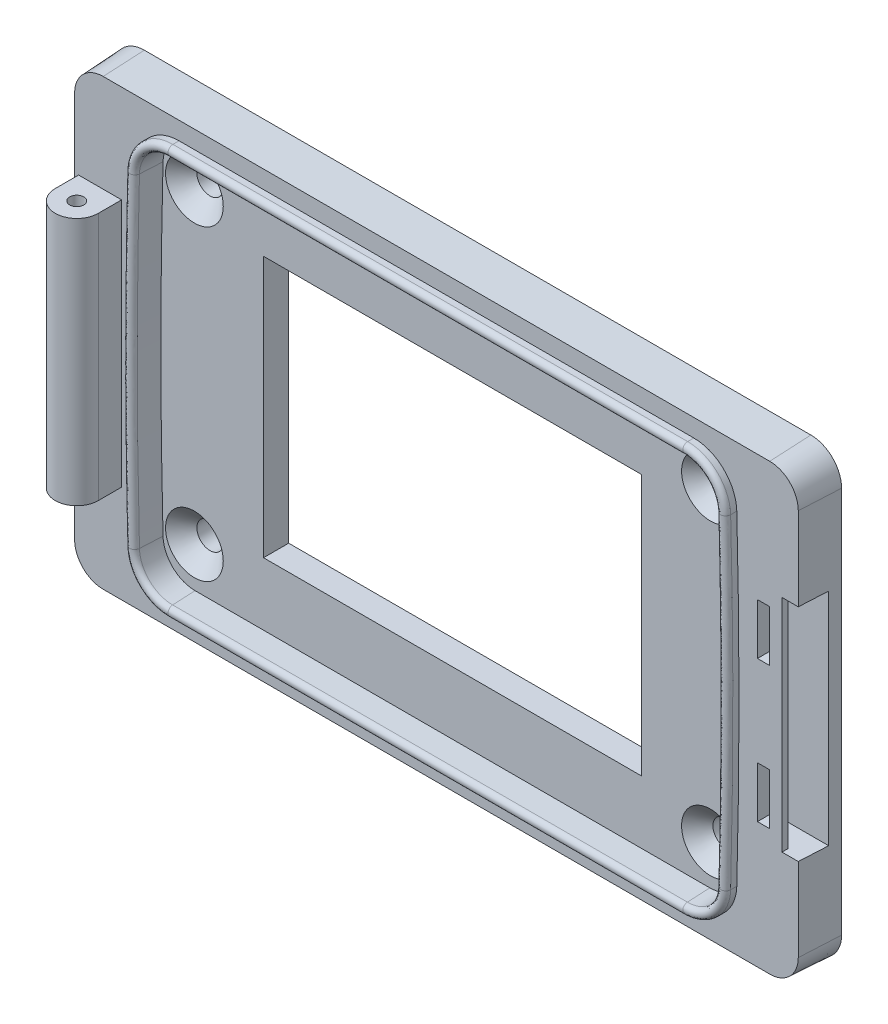
from build123d import *

# Parameters (mm, degrees)
EXTRUDE_1_DEPTH              = 8.5
EXTRUDE_1_DRAFT              = 3
CUT_EXTRUDE_START            = 6.7
CUT_EXTRUDE_1_DEPTH          = 64.407506731
SKETCH_2_R                   = 1.15
EXTRUDE_2_DEPTH              = 20.25
CUT_EXTRUDE_2_DEPTH          = 17.95
CUT_EXTRUDE_START_2          = 2
SKETCH_1_5_W                 = 2
SKETCH_1_5_H                 = 8.3
CUT_EXTRUDE_3_DEPTH          = 69.984593399
SKETCH_1_6_W                 = 61.5
SKETCH_1_6_H                 = 42.5
EXTRUDE_3_DEPTH              = 4.1
SKETCH_1_7_R                 = 3.75
EXTRUDE_4_DEPTH              = 5
HOLE_WIZARD_M4_1_D           = 4.3
HOLE_WIZARD_M4_1_CSINK_D     = 9.4
HOLE_WIZARD_M4_1_CSINK_ANGLE = 90
FILLET_1_R                   = 0.79762


with BuildPart() as part:
    # ｽｹｯﾁ1 → ﾎﾞｽ - 押し出し1 (with draft: the straight prism first)
    with BuildSketch(Plane.XY):
        with BuildLine():
            ThreePointArc((-59.25, -31.5), (-57.785533906, -35.035533906), (-54.25, -36.5))
            Line((-54.25, -36.5), (54.25, -36.5))
            ThreePointArc((54.25, -36.5), (57.785533906, -35.035533906), (59.25, -31.5))
            Line((59.25, -31.5), (59.25, 31.5))
            ThreePointArc((59.25, 31.5), (57.785533906, 35.035533906), (54.25, 36.5))
            Line((54.25, 36.5), (-54.25, 36.5))
            ThreePointArc((-54.25, 36.5), (-57.785533906, 35.035533906), (-59.25, 31.5))
            Line((-59.25, 31.5), (-59.25, -31.5))
        make_face()
        with BuildLine():
            Line((-41.895410903, 31.25), (41.895410903, 31.25))
            ThreePointArc((41.895410903, 31.25), (45.382868101, 29.832965572), (46.893586533, 26.385056917))
            ThreePointArc((46.893586533, 26.385056917), (47.25, 0), (46.893586533, -26.385056917))
            ThreePointArc((46.893586533, -26.385056917), (45.382868101, -29.832965572), (41.895410903, -31.25))
            Line((41.895410903, -31.25), (-41.895410903, -31.25))
            ThreePointArc((-41.895410903, -31.25), (-45.382868101, -29.832965572), (-46.893586533, -26.385056917))
            ThreePointArc((-46.893586533, -26.385056917), (-47.25, 0), (-46.893586533, 26.385056917))
            ThreePointArc((-46.893586533, 26.385056917), (-45.382868101, 29.832965572), (-41.895410903, 31.25))
        make_face(mode=Mode.SUBTRACT)
    extrude(amount=EXTRUDE_1_DEPTH)
    # ﾎﾞｽ - 押し出し1: the draft: its side faces are tilted about the plane it starts from
    extrude_1_sides = [part.faces().sort_by_distance(p)[0] for p in [
        (-57.785533906, -35.035533906, 4.25),
        (0, -36.5, 4.25),
        (57.785533906, -35.035533906, 4.25),
        (59.25, 0, 4.25),
        (57.785533906, 35.035533906, 4.25),
        (0, 36.5, 4.25),
        (-57.785533906, 35.035533906, 4.25),
        (-59.25, 0, 4.25),
        (-45.382868101, 29.832965572, 4.25),
        (0, 31.25, 4.25),
        (45.382868101, 29.832965572, 4.25),
        (47.25, 0, 4.25),
        (45.382868101, -29.832965572, 4.25),
        (0, -31.25, 4.25),
        (-45.382868101, -29.832965572, 4.25),
        (-47.25, 0, 4.25),
    ]]
    draft(extrude_1_sides, Plane.XY, EXTRUDE_1_DRAFT)

    # ｽｹｯﾁ1<3> → ｶｯﾄ - 押し出し1 (cut, through all)
    with BuildSketch(Plane.XY.offset(CUT_EXTRUDE_START)):
        with BuildLine():
            Line((-59.25, -31.5), (-59.25, 31.5))
            ThreePointArc((-59.25, 31.5), (-57.785533906, 35.035533906), (-54.25, 36.5))
            Line((-54.25, 36.5), (54.25, 36.5))
            ThreePointArc((54.25, 36.5), (57.785533906, 35.035533906), (59.25, 31.5))
            Line((59.25, 31.5), (59.25, -31.5))
            ThreePointArc((59.25, -31.5), (57.785533906, -35.035533906), (54.25, -36.5))
            Line((54.25, -36.5), (-54.25, -36.5))
            ThreePointArc((-54.25, -36.5), (-57.785533906, -35.035533906), (-59.25, -31.5))
        make_face()
        with BuildLine():
            Line((-41.895410903, 33.25), (41.895410903, 33.25))
            ThreePointArc((41.895410903, 33.25), (46.77785098, 31.266151801), (48.892856785, 26.439079684))
            ThreePointArc((48.892856785, 26.439079684), (49.25, 0), (48.892856785, -26.439079684))
            ThreePointArc((48.892856785, -26.439079684), (46.77785098, -31.266151801), (41.895410903, -33.25))
            Line((41.895410903, -33.25), (-41.895410903, -33.25))
            ThreePointArc((-41.895410903, -33.25), (-46.77785098, -31.266151801), (-48.892856785, -26.439079684))
            ThreePointArc((-48.892856785, -26.439079684), (-49.25, 0), (-48.892856785, 26.439079684))
            ThreePointArc((-48.892856785, 26.439079684), (-46.77785098, 31.266151801), (-41.895410903, 33.25))
        make_face(mode=Mode.SUBTRACT)
    extrude(amount=CUT_EXTRUDE_1_DEPTH, mode=Mode.SUBTRACT)

    # ｽｹｯﾁ2 → ﾎﾞｽ - 押し出し2 (add, symmetric)
    with BuildSketch(Plane(origin=(0, 0, 0), x_dir=(1, 0, 0), z_dir=(0, 1, 0))):
        with BuildLine():
            Line((-51.25, 0), (-51.25, -10.5))
            ThreePointArc((-51.25, -10.5), (-54.75, -14), (-58.25, -10.5))
            Line((-58.25, -10.5), (-58.25, 0))
            Line((-58.25, 0), (-51.25, 0))
        make_face()
        with Locations(Location((-54.75, -10.5, 0), (0, 0, 270))):
            Circle(SKETCH_2_R, mode=Mode.SUBTRACT)
    extrude(amount=EXTRUDE_2_DEPTH, both=True)

    # ｽｹｯﾁ2<3> → ｶｯﾄ - 押し出し2 (cut, symmetric)
    with BuildSketch(Plane(origin=(0, 0, 0), x_dir=(1, 0, 0), z_dir=(0, 1, 0))):
        Polygon((58.898867879, -6.7), (59.145184441, -2), (49.452041029, -2), (49.452041029, -4.7), (55.25, -4.7), (56.25, -5.7), (56.25, -6.7), align=None)
    extrude(amount=CUT_EXTRUDE_2_DEPTH, both=True, mode=Mode.SUBTRACT)

    # ｽｹｯﾁ1<5> → ｶｯﾄ - 押し出し3 (cut, through all)
    with BuildSketch(Plane.XY.offset(CUT_EXTRUDE_START_2)):
        with Locations((53.25, 11.5)):
            Rectangle(SKETCH_1_5_W, SKETCH_1_5_H)
        with Locations((53.25, -11.5)):
            Rectangle(SKETCH_1_5_W, SKETCH_1_5_H)
    extrude(amount=CUT_EXTRUDE_3_DEPTH, mode=Mode.SUBTRACT)

    # ｽｹｯﾁ1<6> → ﾎﾞｽ - 押し出し3 (add)
    with BuildSketch(Plane.XY):
        with BuildLine():
            Line((-41.895410903, 33.25), (41.895410903, 33.25))
            ThreePointArc((41.895410903, 33.25), (46.77785098, 31.266151801), (48.892856785, 26.439079684))
            ThreePointArc((48.892856785, 26.439079684), (49.25, 0), (48.892856785, -26.439079684))
            ThreePointArc((48.892856785, -26.439079684), (46.77785098, -31.266151801), (41.895410903, -33.25))
            Line((41.895410903, -33.25), (-41.895410903, -33.25))
            ThreePointArc((-41.895410903, -33.25), (-46.77785098, -31.266151801), (-48.892856785, -26.439079684))
            ThreePointArc((-48.892856785, -26.439079684), (-49.25, 0), (-48.892856785, 26.439079684))
            ThreePointArc((-48.892856785, 26.439079684), (-46.77785098, 31.266151801), (-41.895410903, 33.25))
        make_face()
        Rectangle(SKETCH_1_6_W, SKETCH_1_6_H, mode=Mode.SUBTRACT)
    extrude(amount=EXTRUDE_3_DEPTH)

    # ｽｹｯﾁ1<7> → ﾎﾞｽ - 押し出し4 (add)
    with BuildSketch(Plane.XY):
        with Locations((-42, 25)):
            Circle(SKETCH_1_7_R)
        with Locations((-42, -25)):
            Circle(SKETCH_1_7_R)
        with Locations((42, -25)):
            Circle(SKETCH_1_7_R)
        with Locations((42, 25)):
            Circle(SKETCH_1_7_R)
    extrude(amount=-EXTRUDE_4_DEPTH)

    # M4 丸皿ねじ用皿穴1 (through all)
    with Locations(Plane(origin=(-42, 25, 4.1), x_dir=(1, 0, 0), z_dir=(0, 0, 1))):
        with Locations((0, 0), (84, 0), (84, -50), (0, -50)):
            CounterSinkHole(HOLE_WIZARD_M4_1_D / 2, HOLE_WIZARD_M4_1_CSINK_D / 2, counter_sink_angle=HOLE_WIZARD_M4_1_CSINK_ANGLE)

    # ﾌｨﾚｯﾄ1
    fillet_1_edges = [part.edges().sort_by_distance(p)[0] for p in [
        (-41.895410903, 31.580169009, 6.3),
        (-47.695466124, 0, 8.5),
        (-47.223635073, 26.393975239, 6.3),
        (-45.693576909, -30.152183529, 8.5),
        (-47.223635073, -26.393975239, 6.3),
        (0, -31.695466124, 8.5),
        (-41.895410903, -31.580169009, 6.3),
        (45.693576909, -30.152183529, 8.5),
        (41.895410903, -31.580169009, 6.3),
        (47.223635073, -26.393975239, 6.3),
        (45.693576909, 30.152183529, 8.5),
        (47.223635073, 26.393975239, 6.3),
        (0, 31.695466124, 8.5),
        (41.895410903, 31.580169009, 6.3),
        (-45.693576909, 30.152183529, 8.5),
        (47.695466124, 0, 8.5),
        (0, 33.25, 8.5),
        (46.77785098, 31.266151801, 8.5),
        (46.77785098, -31.266151801, 8.5),
        (0, -33.25, 8.5),
        (-46.77785098, -31.266151801, 8.5),
        (-49.25, 0, 8.5),
        (-41.895410903, 33.25, 7.6),
        (-46.77785098, 31.266151801, 8.5),
        (-48.892856785, 26.439079684, 7.6),
        (-48.892856785, -26.439079684, 7.6),
        (-41.895410903, -33.25, 7.6),
        (41.895410903, -33.25, 7.6),
        (48.892856785, -26.439079684, 7.6),
        (49.25, 0, 8.5),
        (48.892856785, 26.439079684, 7.6),
        (41.895410903, 33.25, 7.6),
    ]]
    fillet(fillet_1_edges, radius=FILLET_1_R - 0.0001)  # a hair under: the kernel refuses the full size


solid = part.part
